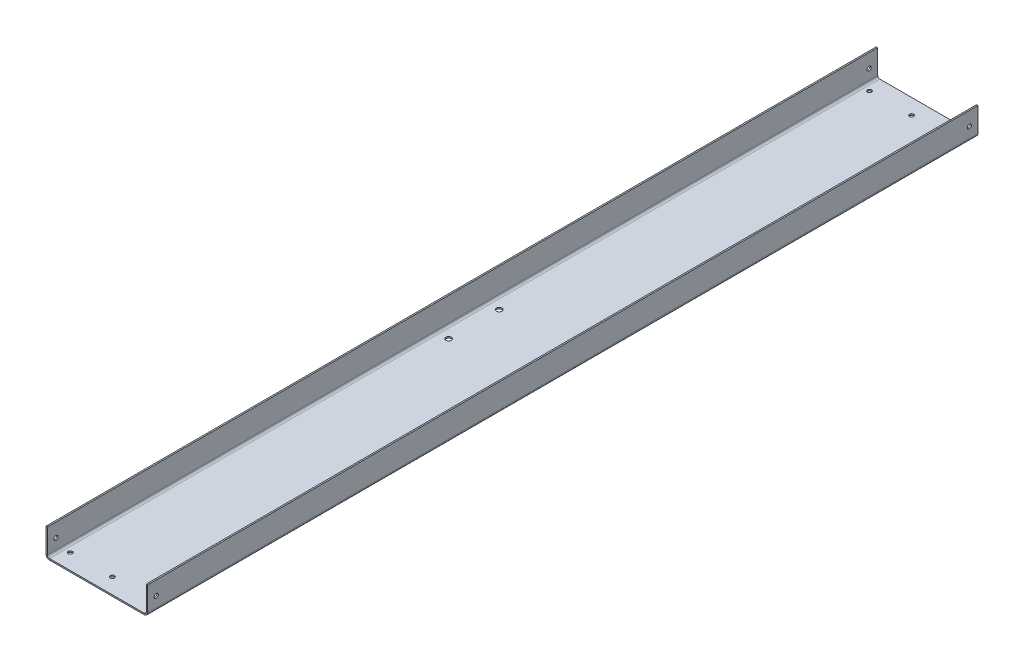
from build123d import *

# Parameters (mm, degrees)
SKETCH1_W                      = 294
SKETCH1_H                      = 2402
BASE_FLANGE1_DEPTH             = 4
EDGE_FLANGE1_STRIP_W           = 28
EDGE_FLANGE1_STRIP_H           = 4
EDGE_FLANGE1_STRIP_CUT_DEPTH   = 2402
EDGE_FLANGE1_STRIP_2_W         = 28
EDGE_FLANGE1_STRIP_2_H         = 4
EDGE_FLANGE1_STRIP_CUT_2_DEPTH = 2402
EDGE_FLANGE1_DEPTH             = 2402
EDGE_FLANGE1_BEND_DEPTH        = 2402
SKETCH20_R                     = 8
CUT_EXTRUDE3_DEPTH             = 10
LPATTERN1_COUNT                = 2
LPATTERN1_PITCH                = 220
LPATTERN1_COUNT_DIR2           = 2
LPATTERN1_PITCH_DIR2           = 146
SKETCH21_R                     = 6
CUT_EXTRUDE4_DEPTH             = 10
SKETCH22_R                     = 6
CUT_EXTRUDE5_DEPTH             = 10
SKETCH23_R                     = 6
CUT_EXTRUDE6_DEPTH             = 1239.794979002


# Sheet-metal steps are written as plain solids
with BuildPart() as part:
    # Sketch1 → Base-Flange1 (new body)
    with BuildSketch(Plane(origin=(0, 0, 0), x_dir=(1, 0, 0), z_dir=(0, 1, 0))):
        Rectangle(SKETCH1_W, SKETCH1_H)
    extrude(amount=-BASE_FLANGE1_DEPTH)

    # Edge-Flange1 strip (across the edge) → Edge-Flange1 strip cut (cut)
    with BuildSketch(Plane(origin=(147, 0, 1201), x_dir=(-1, 0, 0), z_dir=(0, 0, -1))):
        with Locations((-4, -2)):
            Rectangle(EDGE_FLANGE1_STRIP_W, EDGE_FLANGE1_STRIP_H)
    extrude(amount=EDGE_FLANGE1_STRIP_CUT_DEPTH, mode=Mode.SUBTRACT)

    # Edge-Flange1 strip 2 (across the edge) → Edge-Flange1 strip cut 2 (cut)
    with BuildSketch(Plane(origin=(-147, 0, -1201), x_dir=(1, 0, 0), z_dir=(0, 0, 1))):
        with Locations((-4, -2)):
            Rectangle(EDGE_FLANGE1_STRIP_2_W, EDGE_FLANGE1_STRIP_2_H)
    extrude(amount=EDGE_FLANGE1_STRIP_CUT_2_DEPTH, mode=Mode.SUBTRACT)

    # Edge-Flange1 section (across the edge) → Edge-Flange1 (add)
    with BuildSketch(Plane(origin=(147, 0, 1201), x_dir=(-1, 0, 0), z_dir=(0, 0, -1))):
        with BuildLine():
            Line((0, 6), (0, 76))
            Line((0, 76), (4, 76))
            Line((4, 76), (4, 6))
            ThreePointArc((4, 6), (5.757359313, 1.757359313), (10, 0))
            Line((10, 0), (10, -4))
            ThreePointArc((10, -4), (2.928932188, -1.071067812), (0, 6))
        make_face()
    extrude(amount=EDGE_FLANGE1_DEPTH)

    # Edge-Flange1 section 2 (across the edge) → Edge-Flange1 bend (add)
    with BuildSketch(Plane(origin=(-147, 0, -1201), x_dir=(1, 0, 0), z_dir=(0, 0, 1))):
        with BuildLine():
            Line((0, 6), (0, 76))
            Line((0, 76), (4, 76))
            Line((4, 76), (4, 6))
            ThreePointArc((4, 6), (5.757359313, 1.757359313), (10, 0))
            Line((10, 0), (10, -4))
            ThreePointArc((10, -4), (2.928932188, -1.071067812), (0, 6))
        make_face()
    extrude(amount=EDGE_FLANGE1_BEND_DEPTH)

    # Sketch20 → Cut-Extrude3 (cut)
    with BuildSketch(Plane.XZ.offset(4)):
        with Locations(Location((-110, 73, 0), (0, 0, 270))):
            Circle(SKETCH20_R)
    cut_extrude3 = extrude(amount=-CUT_EXTRUDE3_DEPTH, mode=Mode.SUBTRACT)

    # LPattern1: Cut-Extrude3 2 × 2
    with Locations(*[(i * LPATTERN1_PITCH, 0, -j * LPATTERN1_PITCH_DIR2) for i in range(LPATTERN1_COUNT) for j in range(LPATTERN1_COUNT_DIR2) if (i, j) != (0, 0)]):
        add(cut_extrude3, mode=Mode.SUBTRACT)

    # Sketch21 → Cut-Extrude4 (cut)
    with BuildSketch(Plane.XZ.offset(4)):
        with Locations(Location((-122, 1156, 0), (0, 0, 270))):
            Circle(SKETCH21_R)
        with Locations(Location((122, 1156, 0), (0, 0, 270))):
            Circle(SKETCH21_R)
    cut_extrude4 = extrude(amount=-CUT_EXTRUDE4_DEPTH, mode=Mode.SUBTRACT)

    # Sketch22 → Cut-Extrude5 (cut)
    with BuildSketch(Plane.XZ.offset(4)):
        with Locations(Location((0, 1156, 0), (0, 0, 270))):
            Circle(SKETCH22_R)
    cut_extrude5 = extrude(amount=-CUT_EXTRUDE5_DEPTH, mode=Mode.SUBTRACT)

    # Sketch23 → Cut-Extrude6 (cut, through all)
    with BuildSketch(Plane.ZY.offset(147)):
        with Locations(Location((1176, 36, 0), (0, 0, 270))):
            Circle(SKETCH23_R)
    cut_extrude6 = extrude(amount=-CUT_EXTRUDE6_DEPTH, mode=Mode.SUBTRACT)

    # Mirror1: Cut-Extrude4, Cut-Extrude5, Cut-Extrude6 across plane
    add(cut_extrude4.mirror(Plane.XY), mode=Mode.SUBTRACT)
    add(cut_extrude5.mirror(Plane.XY), mode=Mode.SUBTRACT)
    add(cut_extrude6.mirror(Plane.XY), mode=Mode.SUBTRACT)


solid = part.part
